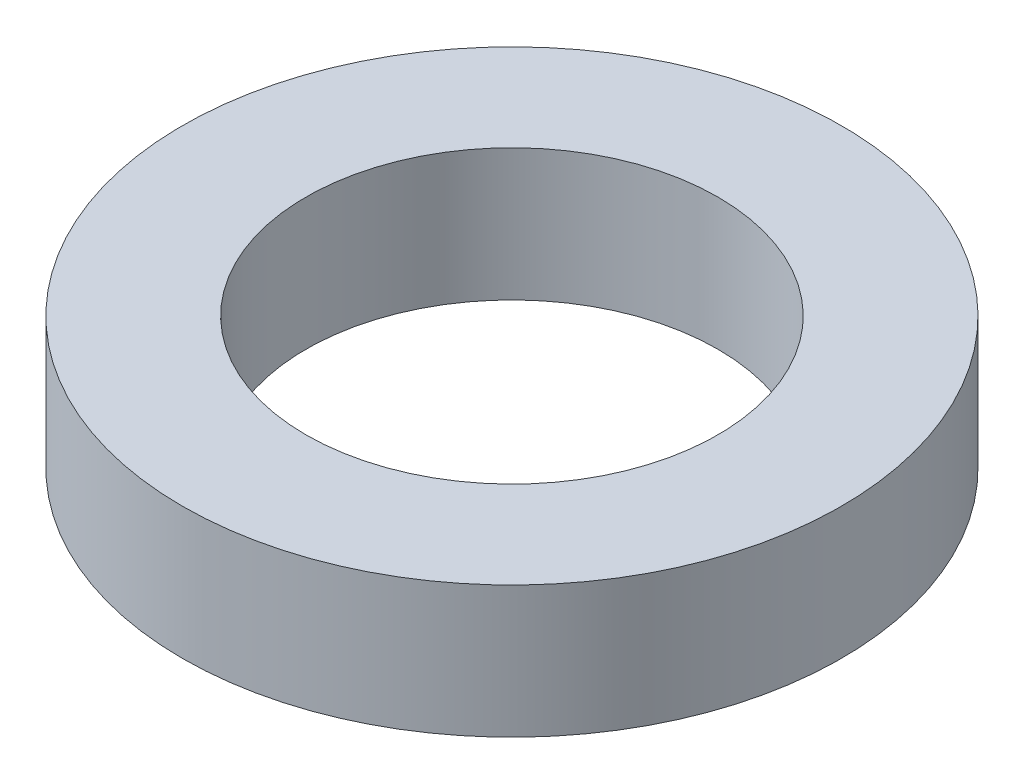
from build123d import *

# Parameters (mm, degrees)
SKETCH1_R           = 60
BOSS_EXTRUDE1_DEPTH = 24
SKETCH2_R           = 37.5
CUT_EXTRUDE1_DEPTH  = 89.18163074


with BuildPart() as part:
    # Sketch1 → Boss-Extrude1 (new body)
    with BuildSketch(Plane(origin=(0, 0, 0), x_dir=(1, 0, 0), z_dir=(0, 1, 0))):
        Circle(SKETCH1_R)
    extrude(amount=BOSS_EXTRUDE1_DEPTH)

    # Sketch2 → Cut-Extrude1 (cut, through all)
    with BuildSketch(Plane(origin=(0, 0, 0), x_dir=(1, 0, 0), z_dir=(0, 1, 0))):
        Circle(SKETCH2_R)
    extrude(amount=CUT_EXTRUDE1_DEPTH, mode=Mode.SUBTRACT)


solid = part.part
